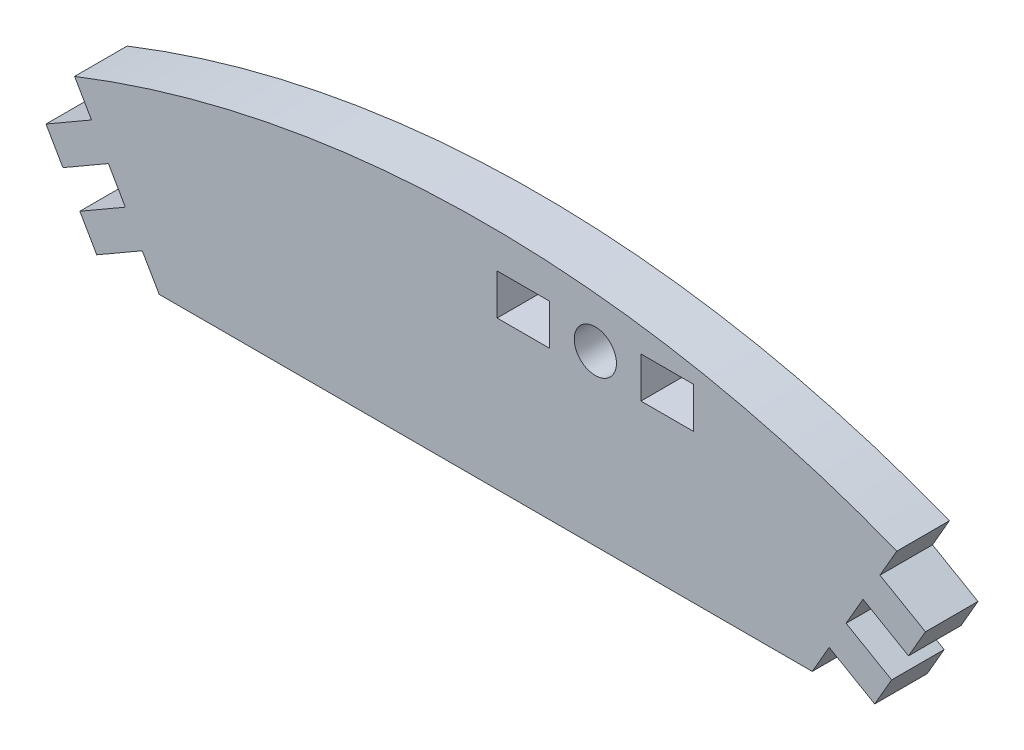
from build123d import *

# Parameters (mm, degrees)
BOSS_EXTRUDE1_DEPTH = 5.15
SKETCH2_R           = 2.0675
SKETCH2_W           = 5.15
SKETCH2_H           = 4
CUT_EXTRUDE1_DEPTH  = 119.251226158


with BuildPart() as part:
    # Sketch1 → Boss-Extrude1 (new body)
    with BuildSketch(Plane.XY):
        with BuildLine():
            Line((-32, 88), (32, 88))
            Line((32, 88), (33.657729839, 90.871272306))
            Line((33.657729839, 90.871272306), (38.117760668, 88.296272306))
            Line((38.117760668, 88.296272306), (39.775490507, 91.167544613))
            Line((39.775490507, 91.167544613), (35.315459678, 93.742544613))
            Line((35.315459678, 93.742544613), (36.973189517, 96.613816919))
            Line((36.973189517, 96.613816919), (41.433220346, 94.038816919))
            Line((41.433220346, 94.038816919), (43.090950185, 96.910089225))
            Line((43.090950185, 96.910089225), (38.630919356, 99.485089225))
            Line((38.630919356, 99.485089225), (40.288649195, 102.356361532))
            ThreePointArc((40.288649195, 102.356361532), (0, 110), (-40.288649195, 102.356361532))
            Line((-40.288649195, 102.356361532), (-38.630919356, 99.485089225))
            Line((-38.630919356, 99.485089225), (-43.090950185, 96.910089225))
            Line((-43.090950185, 96.910089225), (-41.433220346, 94.038816919))
            Line((-41.433220346, 94.038816919), (-36.973189517, 96.613816919))
            Line((-36.973189517, 96.613816919), (-35.315459678, 93.742544613))
            Line((-35.315459678, 93.742544613), (-39.775490507, 91.167544613))
            Line((-39.775490507, 91.167544613), (-38.117760668, 88.296272306))
            Line((-38.117760668, 88.296272306), (-33.657729839, 90.871272306))
            Line((-33.657729839, 90.871272306), (-32, 88))
        make_face()
    extrude(amount=BOSS_EXTRUDE1_DEPTH)

    # Sketch2 → Cut-Extrude1 (cut, through all)
    with BuildSketch(Plane.XY.offset(5.15)):
        with Locations((10.74, 104.550558367)):
            Circle(SKETCH2_R)
        with Locations((17.786830638, 104.550558367)):
            Rectangle(SKETCH2_W, SKETCH2_H)
        with Locations((3.693169362, 104.550558367)):
            Rectangle(SKETCH2_W, SKETCH2_H)
    extrude(amount=-CUT_EXTRUDE1_DEPTH, mode=Mode.SUBTRACT)


solid = part.part
